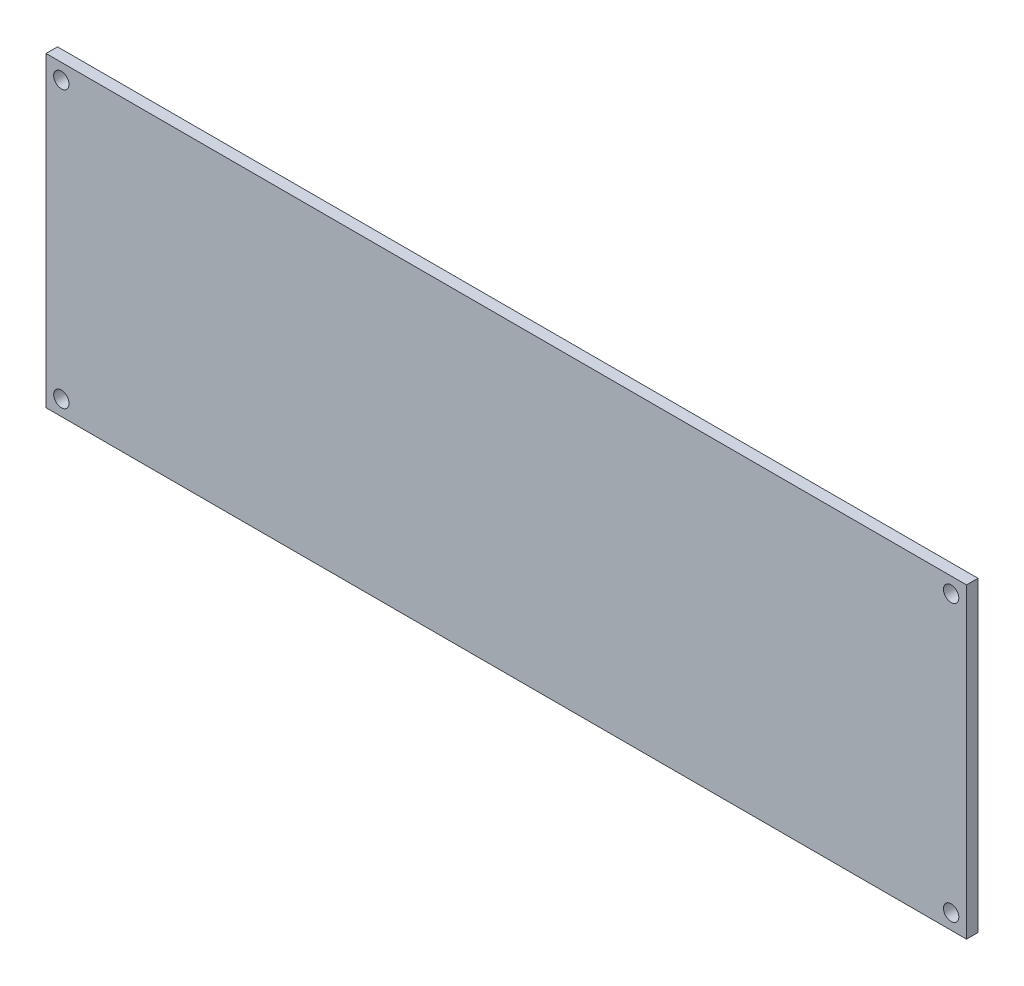
from build123d import *

# Parameters (mm, degrees)
SKETCH_1_W      = 120
SKETCH_1_H      = 40
SKETCH_1_R      = 1
EXTRUDE_1_DEPTH = 1.5


with BuildPart() as part:
    # Эскиз1 → Бобышка-Вытянуть1 (new body)
    with BuildSketch(Plane.XY):
        with Locations((60, 20)):
            Rectangle(SKETCH_1_W, SKETCH_1_H)
        with Locations((2, 38)):
            Circle(SKETCH_1_R, mode=Mode.SUBTRACT)
        with Locations((118, 38)):
            Circle(SKETCH_1_R, mode=Mode.SUBTRACT)
        with Locations((118, 2)):
            Circle(SKETCH_1_R, mode=Mode.SUBTRACT)
        with Locations((2, 2)):
            Circle(SKETCH_1_R, mode=Mode.SUBTRACT)
    extrude(amount=EXTRUDE_1_DEPTH)


solid = part.part
